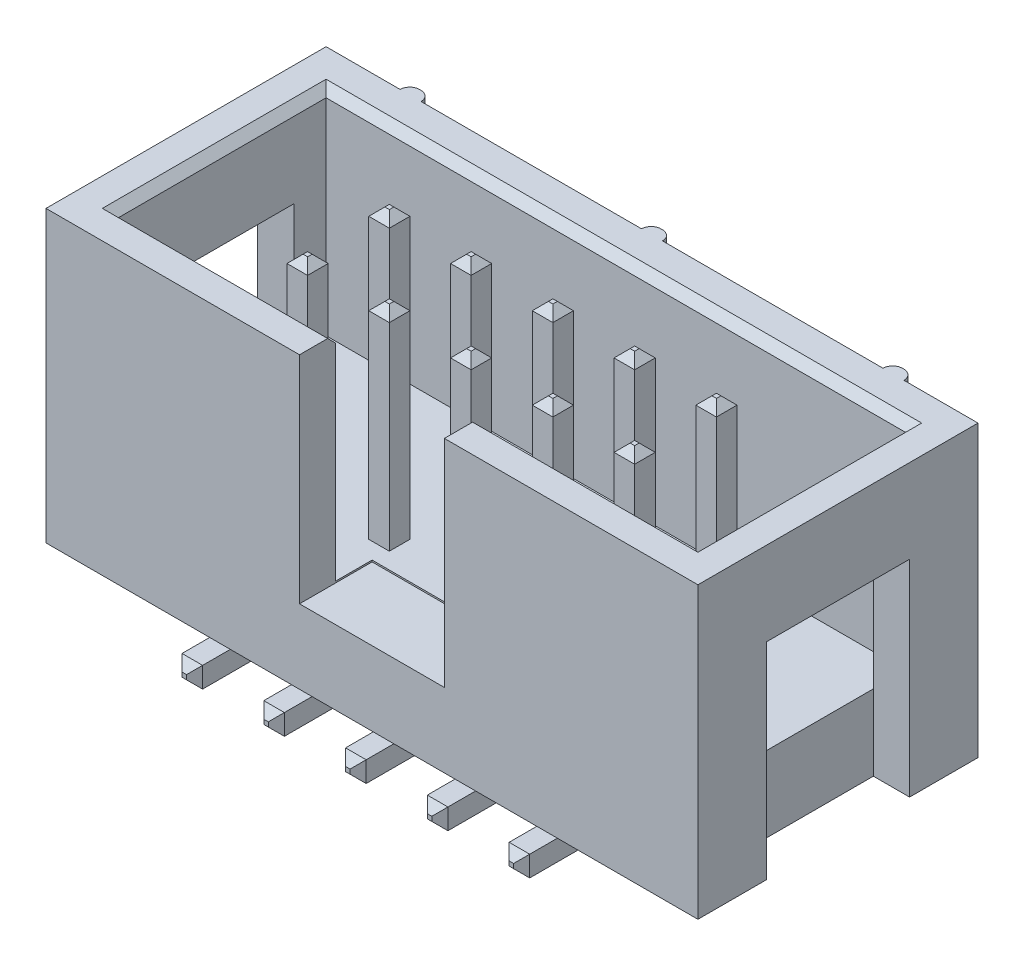
from build123d import *

# Parameters (mm, degrees)
SKETCH1_W           = 20.25
SKETCH1_H           = 8.7
BOSS_EXTRUDE1_DEPTH = 9
SKETCH2_W           = 0.65
SKETCH2_H           = 9
BOSS_EXTRUDE2_DEPTH = 0.3
FILLET1_R           = 0.3
SKETCH3_W           = 18
SKETCH3_H           = 6.45
CUT_EXTRUDE1_DEPTH  = 6.65
SKETCH4_W           = 4.5
SKETCH4_H           = 2.254199096
CUT_EXTRUDE2_DEPTH  = 6.7
SKETCH5_W           = 4.45
SKETCH5_H           = 6.4
CUT_EXTRUDE3_DEPTH  = 1.125
BASE_FLANGE1_DEPTH  = 0.64
CHAMFER1_SIZE       = 0.25
CHAMFER2_SIZE       = 0.25
LPATTERN1_COUNT     = 5
LPATTERN1_PITCH     = 2.54
CHAMFER3_SIZE       = 0.25


# Sheet-metal steps are written as plain solids
with BuildPart() as part:
    # Sketch1 → Boss-Extrude1 (new body)
    with BuildSketch(Plane(origin=(0, 0, 0), x_dir=(1, 0, 0), z_dir=(0, 1, 0))):
        Rectangle(SKETCH1_W, SKETCH1_H)
    extrude(amount=BOSS_EXTRUDE1_DEPTH)

    # Sketch2 → Boss-Extrude2 (add)
    with BuildSketch(Plane(origin=(0, 0, -4.35), x_dir=(-1, 0, 0), z_dir=(0, 0, -1))):
        with Locations((0, 4.5)):
            Rectangle(SKETCH2_W, SKETCH2_H)
        with Locations((7.5, 4.5)):
            Rectangle(SKETCH2_W, SKETCH2_H)
        with Locations((-7.5, 4.5)):
            Rectangle(SKETCH2_W, SKETCH2_H)
    extrude(amount=BOSS_EXTRUDE2_DEPTH)

    # Fillet1
    fillet1_edges = [part.edges().sort_by_distance(p)[0] for p in [
        (-7.825, 4.5, -4.65),
        (-7.175, 4.5, -4.65),
        (-0.325, 4.5, -4.65),
        (0.325, 4.5, -4.65),
        (7.175, 4.5, -4.65),
        (7.825, 4.5, -4.65),
    ]]
    fillet(fillet1_edges, radius=FILLET1_R - 0.0001)  # a hair under: the kernel refuses the full size

    # Sketch3 → Cut-Extrude1 (cut)
    with BuildSketch(Plane(origin=(0, 9, 0), x_dir=(1, 0, 0), z_dir=(0, 1, 0))):
        Rectangle(SKETCH3_W, SKETCH3_H)
    extrude(amount=-CUT_EXTRUDE1_DEPTH, mode=Mode.SUBTRACT)

    # Sketch4 → Cut-Extrude2 (cut)
    with BuildSketch(Plane(origin=(0, 9, 0), x_dir=(1, 0, 0), z_dir=(0, 1, 0))):
        with Locations((0, -3.222900452)):
            Rectangle(SKETCH4_W, SKETCH4_H)
    extrude(amount=-CUT_EXTRUDE2_DEPTH, mode=Mode.SUBTRACT)

    # Sketch5 → Cut-Extrude3 (cut)
    with BuildSketch(Plane(origin=(10.125, 0, 0), x_dir=(0, 0, -1), z_dir=(1, 0, 0))):
        with Locations((0, 3.2)):
            Rectangle(SKETCH5_W, SKETCH5_H)
    cut_extrude3 = extrude(amount=-CUT_EXTRUDE3_DEPTH, mode=Mode.SUBTRACT)

    # Mirror2: Cut-Extrude3 across plane
    add(cut_extrude3.mirror(Plane(origin=(0, 0, 0), x_dir=(0, 0, 1), z_dir=(1, 0, 0))), mode=Mode.SUBTRACT)

    # Chamfer3
    chamfer3_edges = [part.edges().sort_by_distance(p)[0] for p in [
        (5.625, 9, 3.225),
        (9, 9, 0),
        (0, 9, -3.225),
        (-9, 9, 0),
        (-5.625, 9, 3.225),
    ]]
    chamfer(chamfer3_edges, length=CHAMFER3_SIZE)


with BuildPart() as body_2:
    # Sketch7 → Base-Flange1 (new body)
    with BuildSketch(Plane(origin=(-5.4, 0, 0), x_dir=(0, 0, -1), z_dir=(1, 0, 0))):
        with BuildLine():
            Line((0.95, 8.75), (0.95, -0.11))
            ThreePointArc((0.95, -0.11), (1.210674965, -0.739325035), (1.84, -1))
            Line((1.84, -1), (5.1, -1))
            Line((5.1, -1), (5.1, -0.36))
            Line((5.1, -0.36), (1.84, -0.36))
            ThreePointArc((1.84, -0.36), (1.663223305, -0.286776695), (1.59, -0.11))
            Line((1.59, -0.11), (1.59, 8.75))
            Line((1.59, 8.75), (0.95, 8.75))
        make_face()
    extrude(amount=BASE_FLANGE1_DEPTH)

    # Chamfer1
    chamfer1_edges = [body_2.edges().sort_by_distance(p)[0] for p in [
        (-5.08, 8.75, -0.95),
        (-5.08, 8.75, -1.59),
        (-4.76, 8.75, -1.27),
        (-5.4, 8.75, -1.27),
    ]]
    chamfer(chamfer1_edges, length=CHAMFER1_SIZE)

    # Chamfer2
    chamfer2_edges = [body_2.edges().sort_by_distance(p)[0] for p in [
        (-5.08, -0.36, -5.1),
        (-5.08, -1, -5.1),
        (-4.76, -0.68, -5.1),
        (-5.4, -0.68, -5.1),
    ]]
    chamfer(chamfer2_edges, length=CHAMFER2_SIZE)


with BuildPart() as lpattern1_1:
    # LPattern1: pattern copy
    add(body_2.part.moved(Location(Vector(1, 0, 0) * (1 * LPATTERN1_PITCH))))


with BuildPart() as lpattern1_2:
    # LPattern1: pattern copy
    add(body_2.part.moved(Location(Vector(1, 0, 0) * (2 * LPATTERN1_PITCH))))


with BuildPart() as lpattern1_3:
    # LPattern1: pattern copy
    add(body_2.part.moved(Location(Vector(1, 0, 0) * (3 * LPATTERN1_PITCH))))


with BuildPart() as lpattern1_4:
    # LPattern1: pattern copy
    add(body_2.part.moved(Location(Vector(1, 0, 0) * (4 * LPATTERN1_PITCH))))


with BuildPart() as body_7:
    # Mirror3: mirrored copy
    add(body_2.part.mirror(Plane.XY))


with BuildPart() as body_8:
    # Mirror3 2: mirrored copy
    add(lpattern1_1.part.mirror(Plane.XY))


with BuildPart() as body_9:
    # Mirror3 3: mirrored copy
    add(lpattern1_2.part.mirror(Plane.XY))


with BuildPart() as body_10:
    # Mirror3 4: mirrored copy
    add(lpattern1_3.part.mirror(Plane.XY))


with BuildPart() as body_11:
    # Mirror3 5: mirrored copy
    add(lpattern1_4.part.mirror(Plane.XY))


solid = Compound([part.part, body_2.part, lpattern1_1.part, lpattern1_2.part, lpattern1_3.part, lpattern1_4.part, body_7.part, body_8.part, body_9.part, body_10.part, body_11.part])
